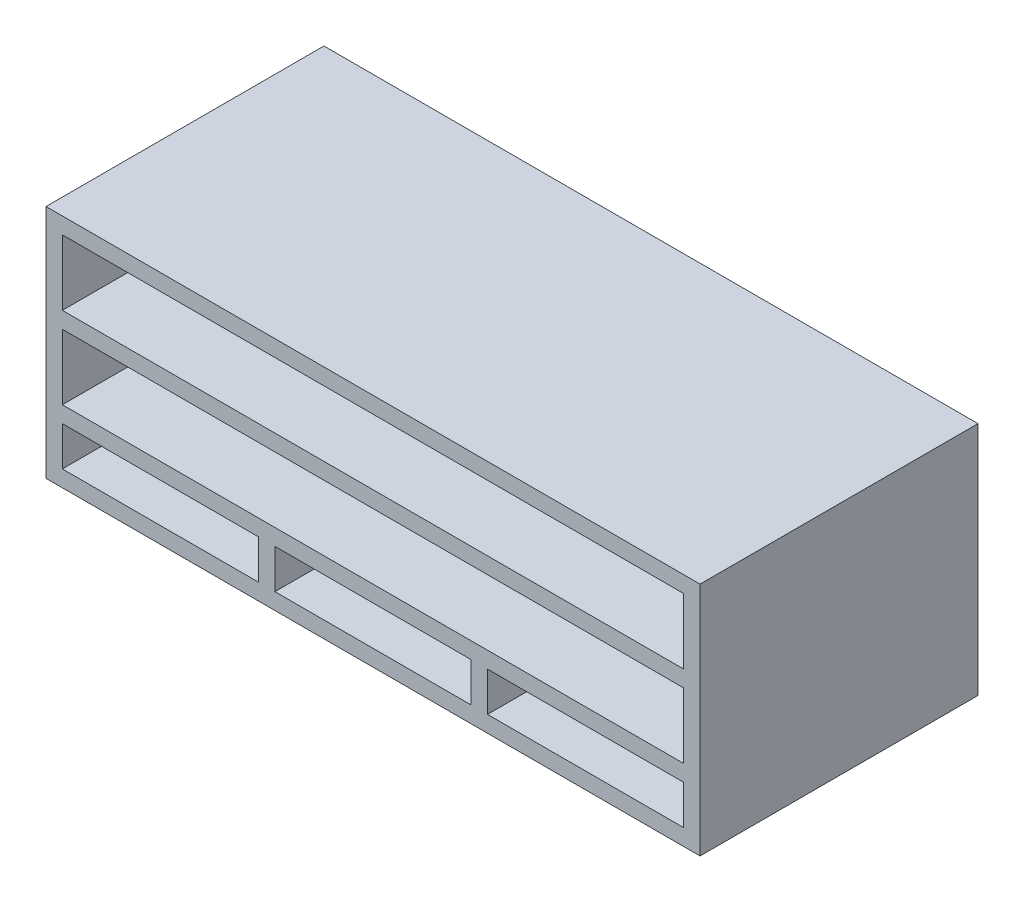
from build123d import *

# Parameters (mm, degrees)
SKETCH1_W           = 127
SKETCH1_H           = 45.72
SKETCH1_W_2         = 120.65
SKETCH1_H_2         = 12.7
SKETCH1_W_3         = 38.1
SKETCH1_H_3         = 7.62
BOSS_EXTRUDE1_DEPTH = 50.8
SKETCH2_W           = 127
SKETCH2_H           = 45.72
BOSS_EXTRUDE2_DEPTH = 3.175


with BuildPart() as part:
    # Sketch1 → Boss-Extrude1 (new body)
    with BuildSketch(Plane.XY):
        with Locations((-63.5, 22.86)):
            Rectangle(SKETCH1_W, SKETCH1_H)
        with Locations((-63.5, 36.195)):
            Rectangle(SKETCH1_W_2, SKETCH1_H_2, mode=Mode.SUBTRACT)
        with Locations((-63.5, 20.32)):
            Rectangle(SKETCH1_W_2, SKETCH1_H_2, mode=Mode.SUBTRACT)
        with Locations((-104.775, 6.985)):
            Rectangle(SKETCH1_W_3, SKETCH1_H_3, mode=Mode.SUBTRACT)
        with Locations((-63.5, 6.985)):
            Rectangle(SKETCH1_W_3, SKETCH1_H_3, mode=Mode.SUBTRACT)
        with Locations((-22.225, 6.985)):
            Rectangle(SKETCH1_W_3, SKETCH1_H_3, mode=Mode.SUBTRACT)
    extrude(amount=BOSS_EXTRUDE1_DEPTH)

    # Sketch2 → Boss-Extrude2 (add)
    with BuildSketch(Plane(origin=(0, 0, 0), x_dir=(-1, 0, 0), z_dir=(0, 0, -1))):
        with Locations((63.5, 22.86)):
            Rectangle(SKETCH2_W, SKETCH2_H)
    extrude(amount=BOSS_EXTRUDE2_DEPTH)


solid = part.part
